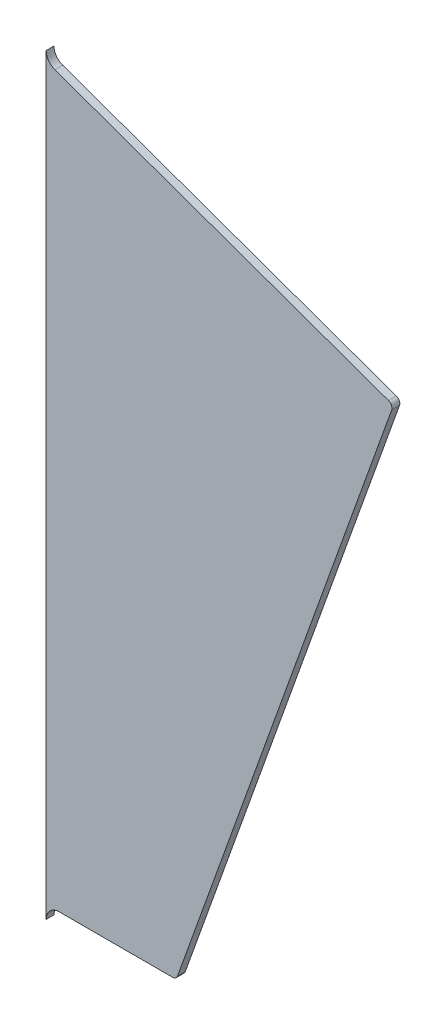
from build123d import *

# Parameters (mm, degrees)
SM_BASE_FLANGE_1_DEPTH = 1.5


# Sheet-metal steps are written as plain solids
with BuildPart() as part:
    # Sketch 1 → Базовая кромка1 (new body)
    with BuildSketch(Plane.XY):
        with BuildLine():
            Line((4, -138.456857017), (25.736707543, -138.456857017))
            ThreePointArc((25.736707543, -138.456857017), (26.312240729, -138.274635442), (26.678024787, -137.794380121))
            Line((26.678024787, -137.794380121), (67.755861168, -23.23251667))
            ThreePointArc((67.755861168, -23.23251667), (67.718820606, -22.468046636), (67.152067027, -21.953676322))
            Line((67.152067027, -21.953676322), (3.15619224, 0.992983188))
            ThreePointArc((3.15619224, 0.992983188), (1.955553938, 1.907443334), (1.5, 3.346276299))
            Line((1.5, 3.346276299), (1.5, -140.956857017))
            ThreePointArc((1.5, -140.956857017), (2.232233047, -139.189090064), (4, -138.456857017))
        make_face()
    extrude(amount=-SM_BASE_FLANGE_1_DEPTH)


solid = part.part
